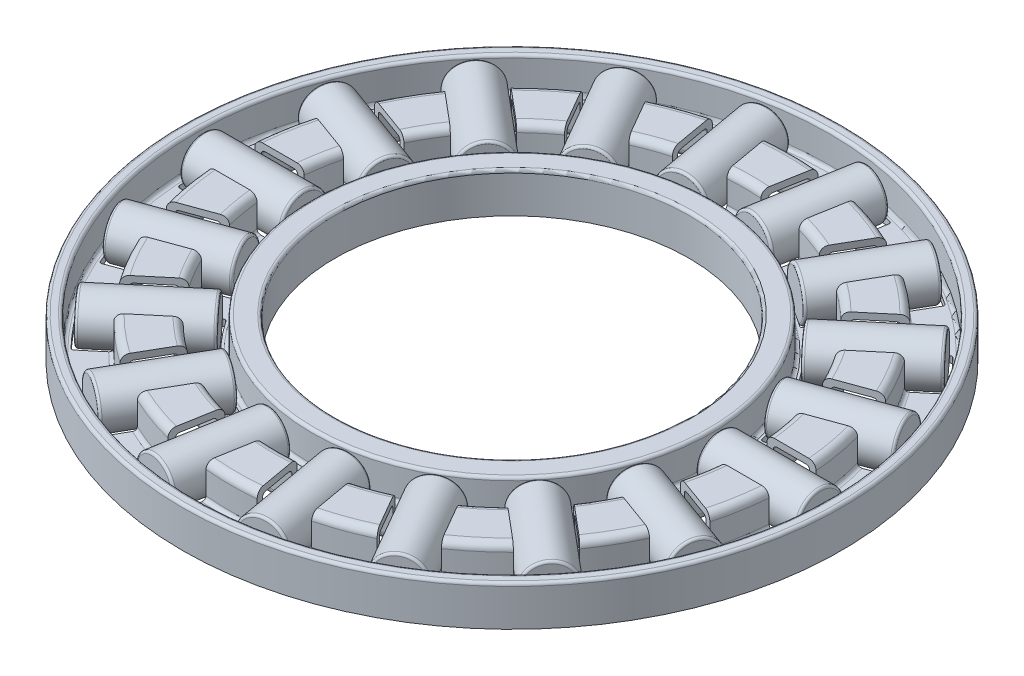
from build123d import *

# Parameters (mm, degrees)
FILLET1_R                = 0.307692308
FILLET2_R                = 0.307692308
FILLET3_R                = 0.125
FILLET4_R                = 0.153846154
CUT_EXTRUDE1_DEPTH       = 20.817227354
FILLET5_R                = 0.100095177
CIRPATTERN1_COUNT        = 18
FILLET5_OF_CIRPATTERN1_R = 0.100095177
SKETCH5_W                = 4.314852742
SKETCH5_H                = 1
FILLET6_R                = 0.100095177
CIRPATTERN2_COUNT        = 18


with BuildPart() as part:
    # Sketch3 → Revolve1 (revolve)
    with BuildSketch(Plane(origin=(0, 0, 0), x_dir=(0, 0, -1), z_dir=(1, 0, 0))):
        Polygon((7.844, -0.85), (7.844, 0.577025641), (8.172, 0.577025641), (8.172, -0.85), (10.150102564, -0.85), (10.150102564, 0.577025641), (11.688564103, 0.577025641), (11.688564103, -0.85), (13.666666667, -0.85), (13.666666667, 0.577025641), (13.833333333, 0.577025641), (13.833333333, -0.85), (14, -0.85), (14, 0.85), (13.5, 0.85), (13.5, -0.577025641), (11.961538462, -0.577025641), (11.961538462, 0.85), (9.877128205, 0.85), (9.877128205, -0.577025641), (8.5, -0.577025641), (8.5, 0.85), (7.516, 0.85), (7.516, -0.85), align=None)
    revolve(axis=Axis((0, 1, 0), (0, -1, 0)))

    # Fillet1
    fillet1_edges = [part.edges().sort_by_distance(p)[0] for p in [
        (0, -0.85, 11.688564103),
        (0, -0.85, 13.666666667),
        (0, -0.85, 8.172),
        (0, -0.85, 10.150102564),
    ]]
    fillet(fillet1_edges, radius=FILLET1_R)

    # Fillet2
    fillet2_edges = [part.edges().sort_by_distance(p)[0] for p in [
        (0, 0.85, 11.961538462),
        (0, 0.85, 9.877128205),
    ]]
    fillet(fillet2_edges, radius=FILLET2_R)

    # Fillet3
    fillet3_edges = [part.edges().sort_by_distance(p)[0] for p in [
        (0, 0.85, 13.5),
        (0, 0.85, 14),
        (0, 0.85, 8.5),
        (0, 0.85, 7.516),
    ]]
    fillet(fillet3_edges, radius=FILLET3_R)

    # Fillet4
    fillet4_edges = [part.edges().sort_by_distance(p)[0] for p in [
        (0, 0.577025641, 10.150102564),
        (0, 0.577025641, 11.688564103),
        (0, -0.577025641, 13.5),
        (0, -0.577025641, 11.961538462),
        (0, -0.577025641, 9.877128205),
        (0, -0.577025641, 8.5),
    ]]
    fillet(fillet4_edges, radius=FILLET4_R)

    # Sketch4 → Cut-Extrude1 (cut, symmetric)
    with BuildSketch(Plane(origin=(0, 0, 0), x_dir=(1, 0, 0), z_dir=(0, 1, 0))):
        with BuildLine():
            Line((8.692669325, 1), (13.212210262, 1))
            ThreePointArc((13.212210262, 1), (13.25, 0), (13.212210262, -1))
            Line((13.212210262, -1), (8.692669325, -1))
            ThreePointArc((8.692669325, -1), (8.75, 0), (8.692669325, 1))
        make_face()
    cut_extrude1 = extrude(amount=CUT_EXTRUDE1_DEPTH, both=True, mode=Mode.SUBTRACT)

    # Fillet5
    fillet5_edges = [part.edges().sort_by_distance(p)[0] for p in [
        (13.212210262, -0.713512821, -1),
        (13.212210262, -0.713512821, 1),
        (8.692669325, -0.713512821, -1),
        (8.692669325, -0.713512821, 1),
    ]]
    fillet(fillet5_edges, radius=FILLET5_R)

    # CirPattern1: Cut-Extrude1 ×18 about axis
    cirpattern1_axis = Axis((0, 1, 0), (0, -1, 0))
    for i in range(1, CIRPATTERN1_COUNT):
        add(cut_extrude1.rotate(cirpattern1_axis, i * 360 / CIRPATTERN1_COUNT), mode=Mode.SUBTRACT)

    # Fillet5 of CirPattern1
    fillet5_of_cirpattern1_edges = [part.edges().sort_by_distance(p)[0] for p in [
        (12.757436631, -0.713512821, 3.579149427),
        (12.073396344, -0.713512821, 5.458534668),
        (8.510457363, -0.713512821, 2.033375388),
        (7.826417077, -0.713512821, 3.912760629),
        (10.763927862, -0.713512821, 7.72660061),
        (9.478352643, -0.713512821, 9.258689496),
        (7.301758642, -0.713512821, 4.821495694),
        (6.016183423, -0.713512821, 6.353584581),
        (7.472130535, -0.713512821, 10.942109727),
        (5.740079727, -0.713512821, 11.942109727),
        (5.212360066, -0.713512821, 7.028072462),
        (3.480309259, -0.713512821, 8.028072462),
        (3.279083988, -0.713512821, 12.837838923),
        (1.309468482, -0.713512821, 13.185135278),
        (2.49427394, -0.713512821, 8.386959968),
        (0.524658434, -0.713512821, 8.734256324),
        (-1.309468482, -0.713512821, 13.185135278),
        (-3.279083988, -0.713512821, 12.837838923),
        (-0.524658434, -0.713512821, 8.734256324),
        (-2.49427394, -0.713512821, 8.386959968),
        (-5.740079727, -0.713512821, 11.942109727),
        (-7.472130535, -0.713512821, 10.942109727),
        (-3.480309259, -0.713512821, 8.028072462),
        (-5.212360066, -0.713512821, 7.028072462),
        (-9.478352643, -0.713512821, 9.258689496),
        (-10.763927862, -0.713512821, 7.72660061),
        (-6.016183423, -0.713512821, 6.353584581),
        (-7.301758642, -0.713512821, 4.821495694),
        (-12.073396344, -0.713512821, 5.458534668),
        (-12.757436631, -0.713512821, 3.579149427),
        (-7.826417077, -0.713512821, 3.912760629),
        (-8.510457363, -0.713512821, 2.033375388),
        (-13.212210262, -0.713512821, 1),
        (-13.212210262, -0.713512821, -1),
        (-8.692669325, -0.713512821, 1),
        (-8.692669325, -0.713512821, -1),
        (-12.757436631, -0.713512821, -3.579149427),
        (-12.073396344, -0.713512821, -5.458534668),
        (-8.510457363, -0.713512821, -2.033375388),
        (-7.826417077, -0.713512821, -3.912760629),
        (-10.763927862, -0.713512821, -7.72660061),
        (-9.478352643, -0.713512821, -9.258689496),
        (-7.301758642, -0.713512821, -4.821495694),
        (-6.016183423, -0.713512821, -6.353584581),
        (-7.472130535, -0.713512821, -10.942109727),
        (-5.740079727, -0.713512821, -11.942109727),
        (-5.212360066, -0.713512821, -7.028072462),
        (-3.480309259, -0.713512821, -8.028072462),
        (-3.279083988, -0.713512821, -12.837838923),
        (-1.309468482, -0.713512821, -13.185135278),
        (-2.49427394, -0.713512821, -8.386959968),
        (-0.524658434, -0.713512821, -8.734256324),
        (1.309468482, -0.713512821, -13.185135278),
        (3.279083988, -0.713512821, -12.837838923),
        (0.524658434, -0.713512821, -8.734256324),
        (2.49427394, -0.713512821, -8.386959968),
        (5.740079727, -0.713512821, -11.942109727),
        (7.472130535, -0.713512821, -10.942109727),
        (3.480309259, -0.713512821, -8.028072462),
        (5.212360066, -0.713512821, -7.028072462),
        (9.478352643, -0.713512821, -9.258689496),
        (10.763927862, -0.713512821, -7.72660061),
        (6.016183423, -0.713512821, -6.353584581),
        (7.301758642, -0.713512821, -4.821495694),
        (12.073396344, -0.713512821, -5.458534668),
        (12.757436631, -0.713512821, -3.579149427),
        (7.826417077, -0.713512821, -3.912760629),
        (8.510457363, -0.713512821, -2.033375388),
    ]]
    fillet(fillet5_of_cirpattern1_edges, radius=FILLET5_OF_CIRPATTERN1_R)


with BuildPart() as body_2:
    # Sketch5 → Revolve2 (revolve)
    with BuildSketch(Plane(origin=(0, 0, 0), x_dir=(1, 0, 0), z_dir=(0, 1, 0))):
        with Locations((10.961650127, 0.5)):
            Rectangle(SKETCH5_W, SKETCH5_H)
    revolve(axis=Axis((13.25, 0, 0), (-1, 0, 0)))

    # Fillet6
    fillet6_edges = [body_2.edges().sort_by_distance(p)[0] for p in [
        (8.804223756, 0, 1),
        (13.119076498, 0, 1),
    ]]
    fillet(fillet6_edges, radius=FILLET6_R)


with BuildPart() as cirpattern2_1:
    # CirPattern2: pattern copy
    add(body_2.part.rotate(Axis((0, 1, 0), (0, -1, 0)), 1 * 360 / CIRPATTERN2_COUNT))


with BuildPart() as cirpattern2_2:
    # CirPattern2: pattern copy
    add(body_2.part.rotate(Axis((0, 1, 0), (0, -1, 0)), 2 * 360 / CIRPATTERN2_COUNT))


with BuildPart() as cirpattern2_3:
    # CirPattern2: pattern copy
    add(body_2.part.rotate(Axis((0, 1, 0), (0, -1, 0)), 3 * 360 / CIRPATTERN2_COUNT))


with BuildPart() as cirpattern2_4:
    # CirPattern2: pattern copy
    add(body_2.part.rotate(Axis((0, 1, 0), (0, -1, 0)), 4 * 360 / CIRPATTERN2_COUNT))


with BuildPart() as cirpattern2_5:
    # CirPattern2: pattern copy
    add(body_2.part.rotate(Axis((0, 1, 0), (0, -1, 0)), 5 * 360 / CIRPATTERN2_COUNT))


with BuildPart() as cirpattern2_6:
    # CirPattern2: pattern copy
    add(body_2.part.rotate(Axis((0, 1, 0), (0, -1, 0)), 6 * 360 / CIRPATTERN2_COUNT))


with BuildPart() as cirpattern2_7:
    # CirPattern2: pattern copy
    add(body_2.part.rotate(Axis((0, 1, 0), (0, -1, 0)), 7 * 360 / CIRPATTERN2_COUNT))


with BuildPart() as cirpattern2_8:
    # CirPattern2: pattern copy
    add(body_2.part.rotate(Axis((0, 1, 0), (0, -1, 0)), 8 * 360 / CIRPATTERN2_COUNT))


with BuildPart() as cirpattern2_9:
    # CirPattern2: pattern copy
    add(body_2.part.rotate(Axis((0, 1, 0), (0, -1, 0)), 9 * 360 / CIRPATTERN2_COUNT))


with BuildPart() as cirpattern2_10:
    # CirPattern2: pattern copy
    add(body_2.part.rotate(Axis((0, 1, 0), (0, -1, 0)), 10 * 360 / CIRPATTERN2_COUNT))


with BuildPart() as cirpattern2_11:
    # CirPattern2: pattern copy
    add(body_2.part.rotate(Axis((0, 1, 0), (0, -1, 0)), 11 * 360 / CIRPATTERN2_COUNT))


with BuildPart() as cirpattern2_12:
    # CirPattern2: pattern copy
    add(body_2.part.rotate(Axis((0, 1, 0), (0, -1, 0)), 12 * 360 / CIRPATTERN2_COUNT))


with BuildPart() as cirpattern2_13:
    # CirPattern2: pattern copy
    add(body_2.part.rotate(Axis((0, 1, 0), (0, -1, 0)), 13 * 360 / CIRPATTERN2_COUNT))


with BuildPart() as cirpattern2_14:
    # CirPattern2: pattern copy
    add(body_2.part.rotate(Axis((0, 1, 0), (0, -1, 0)), 14 * 360 / CIRPATTERN2_COUNT))


with BuildPart() as cirpattern2_15:
    # CirPattern2: pattern copy
    add(body_2.part.rotate(Axis((0, 1, 0), (0, -1, 0)), 15 * 360 / CIRPATTERN2_COUNT))


with BuildPart() as cirpattern2_16:
    # CirPattern2: pattern copy
    add(body_2.part.rotate(Axis((0, 1, 0), (0, -1, 0)), 16 * 360 / CIRPATTERN2_COUNT))


with BuildPart() as cirpattern2_17:
    # CirPattern2: pattern copy
    add(body_2.part.rotate(Axis((0, 1, 0), (0, -1, 0)), 17 * 360 / CIRPATTERN2_COUNT))


solid = Compound([part.part, body_2.part, cirpattern2_1.part, cirpattern2_2.part, cirpattern2_3.part, cirpattern2_4.part, cirpattern2_5.part, cirpattern2_6.part, cirpattern2_7.part, cirpattern2_8.part, cirpattern2_9.part, cirpattern2_10.part, cirpattern2_11.part, cirpattern2_12.part, cirpattern2_13.part, cirpattern2_14.part, cirpattern2_15.part, cirpattern2_16.part, cirpattern2_17.part])
